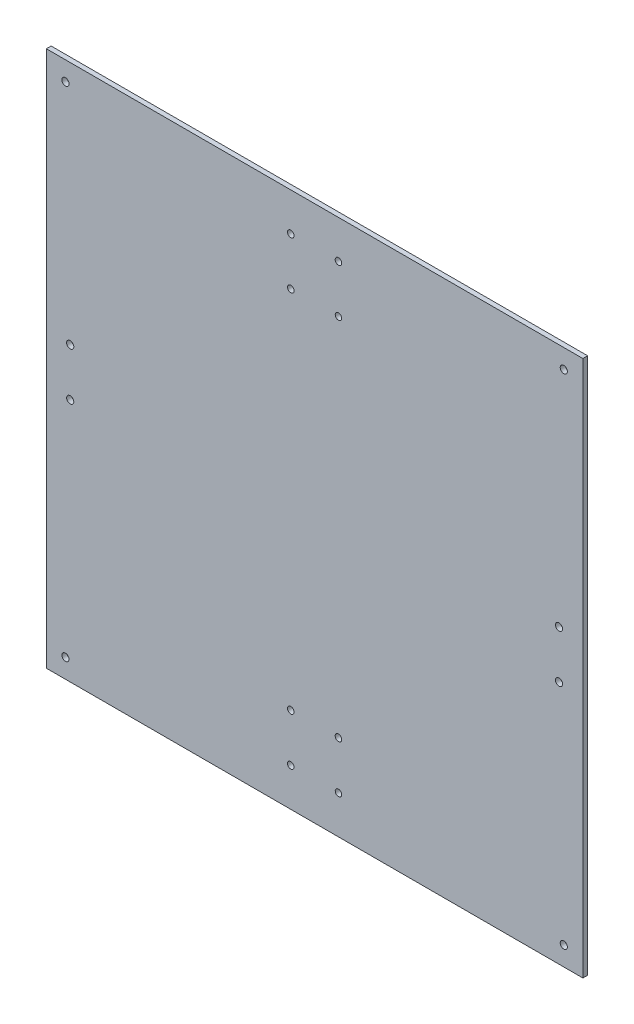
from build123d import *

# Parameters (mm, degrees)
SKETCH1_W           = 225
SKETCH1_H           = 225
SKETCH1_R           = 1.5
SKETCH1_R_2         = 1.35
SKETCH1_R_3         = 1.375
BOSS_EXTRUDE1_DEPTH = 2


with BuildPart() as part:
    # Sketch1 → Boss-Extrude1 (new body)
    with BuildSketch(Plane.XY):
        with Locations((0, -86.5)):
            Rectangle(SKETCH1_W, SKETCH1_H)
        with Locations((104.5, -191)):
            Circle(SKETCH1_R, mode=Mode.SUBTRACT)
        with Locations((104.5, 18)):
            Circle(SKETCH1_R, mode=Mode.SUBTRACT)
        with Locations((-104.5, 18)):
            Circle(SKETCH1_R, mode=Mode.SUBTRACT)
        with Locations((-104.5, -191)):
            Circle(SKETCH1_R, mode=Mode.SUBTRACT)
        with Locations((102.5, -76.5)):
            Circle(SKETCH1_R, mode=Mode.SUBTRACT)
        with Locations((10, -10)):
            Circle(SKETCH1_R_2, mode=Mode.SUBTRACT)
        with Locations((10, 10)):
            Circle(SKETCH1_R_3, mode=Mode.SUBTRACT)
        with Locations((10, -183)):
            Circle(SKETCH1_R_2, mode=Mode.SUBTRACT)
        with Locations((10, -163)):
            Circle(SKETCH1_R_3, mode=Mode.SUBTRACT)
        with Locations((102.5, -96.5)):
            Circle(SKETCH1_R, mode=Mode.SUBTRACT)
        with Locations((-102.5, -96.5)):
            Circle(SKETCH1_R, mode=Mode.SUBTRACT)
        with Locations((-102.5, -76.5)):
            Circle(SKETCH1_R, mode=Mode.SUBTRACT)
        with Locations((-10, -10)):
            Circle(SKETCH1_R_3, mode=Mode.SUBTRACT)
        with Locations((-10, 10)):
            Circle(SKETCH1_R_3, mode=Mode.SUBTRACT)
        with Locations((-10, -183)):
            Circle(SKETCH1_R_3, mode=Mode.SUBTRACT)
        with Locations((-10, -163)):
            Circle(SKETCH1_R_3, mode=Mode.SUBTRACT)
    extrude(amount=BOSS_EXTRUDE1_DEPTH)


solid = part.part
